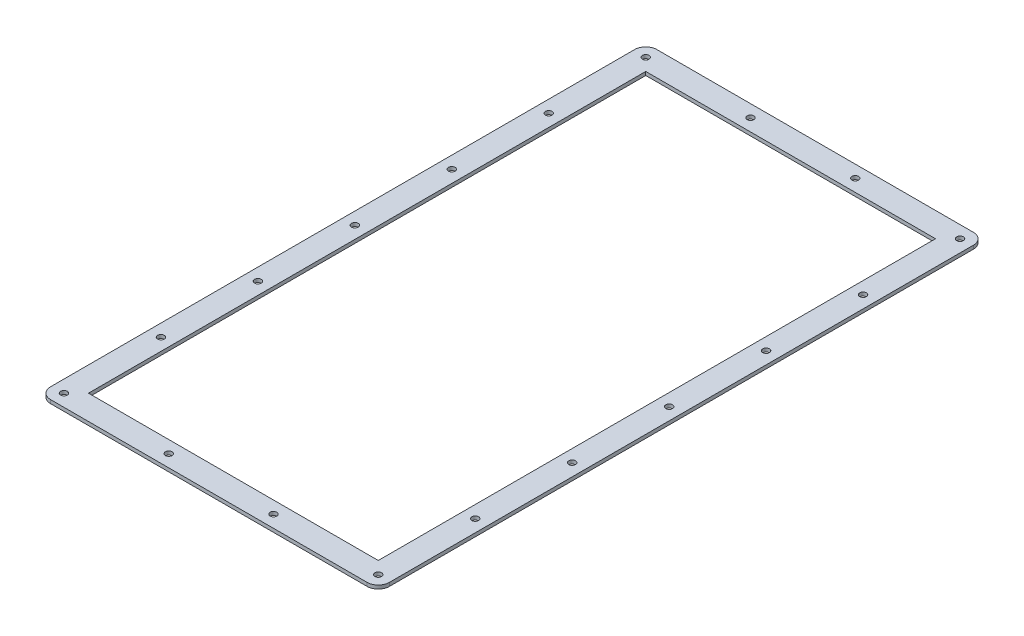
from build123d import *

# Parameters (mm, degrees)
SKETCH1_W           = 304
SKETCH1_H           = 544
SKETCH1_R           = 3
SKETCH1_W_2         = 260
SKETCH1_H_2         = 500
BOSS_EXTRUDE1_DEPTH = 3.175
FILLET1_R           = 10


with BuildPart() as part:
    # Sketch1 → Boss-Extrude1 (new body)
    with BuildSketch(Plane(origin=(0, 0, 0), x_dir=(1, 0, 0), z_dir=(0, 1, 0))):
        Rectangle(SKETCH1_W, SKETCH1_H)
        with Locations((-141, -261)):
            Circle(SKETCH1_R, mode=Mode.SUBTRACT)
        with Locations((-141, -174)):
            Circle(SKETCH1_R, mode=Mode.SUBTRACT)
        with Locations((-47, -261)):
            Circle(SKETCH1_R, mode=Mode.SUBTRACT)
        with Locations((-141, -87)):
            Circle(SKETCH1_R, mode=Mode.SUBTRACT)
        with Locations((-141, 0)):
            Circle(SKETCH1_R, mode=Mode.SUBTRACT)
        with Locations((47, -261)):
            Circle(SKETCH1_R, mode=Mode.SUBTRACT)
        with Locations((141, -261)):
            Circle(SKETCH1_R, mode=Mode.SUBTRACT)
        with Locations((141, -174)):
            Circle(SKETCH1_R, mode=Mode.SUBTRACT)
        with Locations((141, -87)):
            Circle(SKETCH1_R, mode=Mode.SUBTRACT)
        with Locations((141, 0)):
            Circle(SKETCH1_R, mode=Mode.SUBTRACT)
        with Locations((-141, 87)):
            Circle(SKETCH1_R, mode=Mode.SUBTRACT)
        Rectangle(SKETCH1_W_2, SKETCH1_H_2, mode=Mode.SUBTRACT)
        with Locations((-141, 174)):
            Circle(SKETCH1_R, mode=Mode.SUBTRACT)
        with Locations((-141, 261)):
            Circle(SKETCH1_R, mode=Mode.SUBTRACT)
        with Locations((-47, 261)):
            Circle(SKETCH1_R, mode=Mode.SUBTRACT)
        with Locations((141, 87)):
            Circle(SKETCH1_R, mode=Mode.SUBTRACT)
        with Locations((47, 261)):
            Circle(SKETCH1_R, mode=Mode.SUBTRACT)
        with Locations((141, 174)):
            Circle(SKETCH1_R, mode=Mode.SUBTRACT)
        with Locations((141, 261)):
            Circle(SKETCH1_R, mode=Mode.SUBTRACT)
    extrude(amount=BOSS_EXTRUDE1_DEPTH)

    # Fillet1
    fillet1_edges = [part.edges().sort_by_distance(p)[0] for p in [
        (152, 1.5875, 272),
        (-152, 1.5875, 272),
        (152, 1.5875, -272),
        (-152, 1.5875, -272),
    ]]
    fillet(fillet1_edges, radius=FILLET1_R)


solid = part.part
